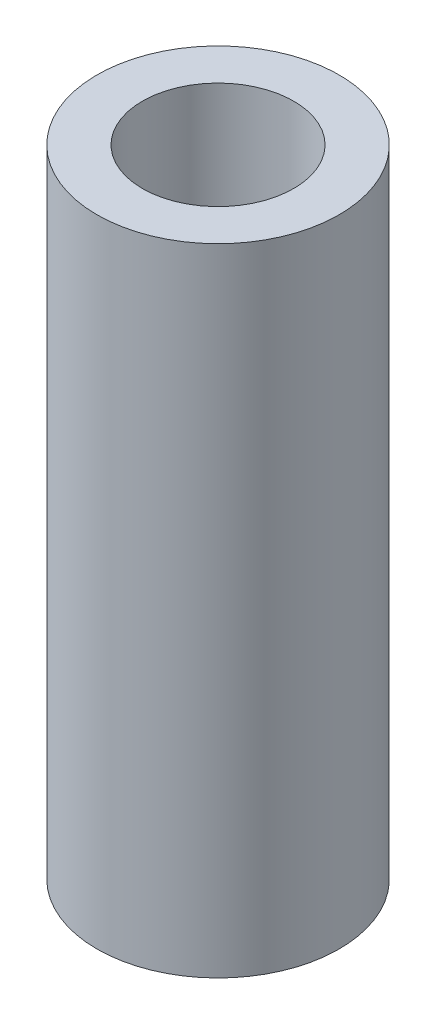
from build123d import *

# Parameters (mm, degrees)
SKETCH1_R           = 4
BOSS_EXTRUDE1_DEPTH = 21
SKETCH2_R           = 3.2
CUT_EXTRUDE1_DEPTH  = 10
SKETCH3_R           = 2.5
CUT_EXTRUDE3_DEPTH  = 10


with BuildPart() as part:
    # Sketch1 → Boss-Extrude1 (new body)
    with BuildSketch(Plane(origin=(0, 0, 0), x_dir=(1, 0, 0), z_dir=(0, 1, 0))):
        with Locations(Location((0, 0, 0), (0, 0, 90))):
            Circle(SKETCH1_R)
    extrude(amount=BOSS_EXTRUDE1_DEPTH)

    # Sketch2 → Cut-Extrude1 (cut)
    with BuildSketch(Plane.XZ):
        with Locations(Location((0, 0, 0), (0, 0, 270))):
            Circle(SKETCH2_R)
    extrude(amount=-CUT_EXTRUDE1_DEPTH, mode=Mode.SUBTRACT)

    # Sketch3 → Cut-Extrude3 (cut)
    with BuildSketch(Plane(origin=(0, 21, 0), x_dir=(1, 0, 0), z_dir=(0, 1, 0))):
        with Locations(Location((0, 0, 0), (0, 0, 270))):
            Circle(SKETCH3_R)
    extrude(amount=-CUT_EXTRUDE3_DEPTH, mode=Mode.SUBTRACT)

    # Cut-Extrude5: read off the stored shape, not the designer's step
    # Cut-Extrude5: loft between two sections, ruled curve by curve
    cut_extrude5_from = [
        Edge.make_three_point_arc((-2.07101841, 14.6, 0), (-2.07101841, 16, 1.4), (-2.07101841, 17.4, 0)),
        Edge.make_three_point_arc((-2.07101841, 17.4, 0), (-2.07101841, 16, -1.4), (-2.07101841, 14.6, 0)),
    ]
    cut_extrude5_to = [
        Edge.make_three_point_arc((-3.999916451, 14.6, 0), (-3.999916451, 16, 1.4), (-3.999916451, 17.4, 0)),
        Edge.make_three_point_arc((-3.999916451, 17.4, 0), (-3.999916451, 16, -1.4), (-3.999916451, 14.6, 0)),
    ]
    cut_extrude5 = Solid(Shell([*[Face.make_surface_from_curves(cut_extrude5_from[k], cut_extrude5_to[k]) for k in range(2)], Face(Wire(cut_extrude5_from)), Face(Wire(cut_extrude5_to))]))
    add(cut_extrude5, mode=Mode.SUBTRACT)

    # Cut-Extrude5 2: loft between two sections, ruled curve by curve
    cut_extrude5_2_from = [
        Edge.make_three_point_arc((-2.877351837, 3.6, 0), (-2.877351837, 5, 1.4), (-2.877351837, 6.4, 0)),
        Edge.make_three_point_arc((-2.877351837, 6.4, 0), (-2.877351837, 5, -1.4), (-2.877351837, 3.6, 0)),
    ]
    cut_extrude5_2_to = [
        Edge.make_three_point_arc((-3.999916451, 3.6, 0), (-3.999916451, 5, 1.4), (-3.999916451, 6.4, 0)),
        Edge.make_three_point_arc((-3.999916451, 6.4, 0), (-3.999916451, 5, -1.4), (-3.999916451, 3.6, 0)),
    ]
    cut_extrude5_2 = Solid(Shell([*[Face.make_surface_from_curves(cut_extrude5_2_from[k], cut_extrude5_2_to[k]) for k in range(2)], Face(Wire(cut_extrude5_2_from)), Face(Wire(cut_extrude5_2_to))]))
    add(cut_extrude5_2, mode=Mode.SUBTRACT)


solid = part.part
